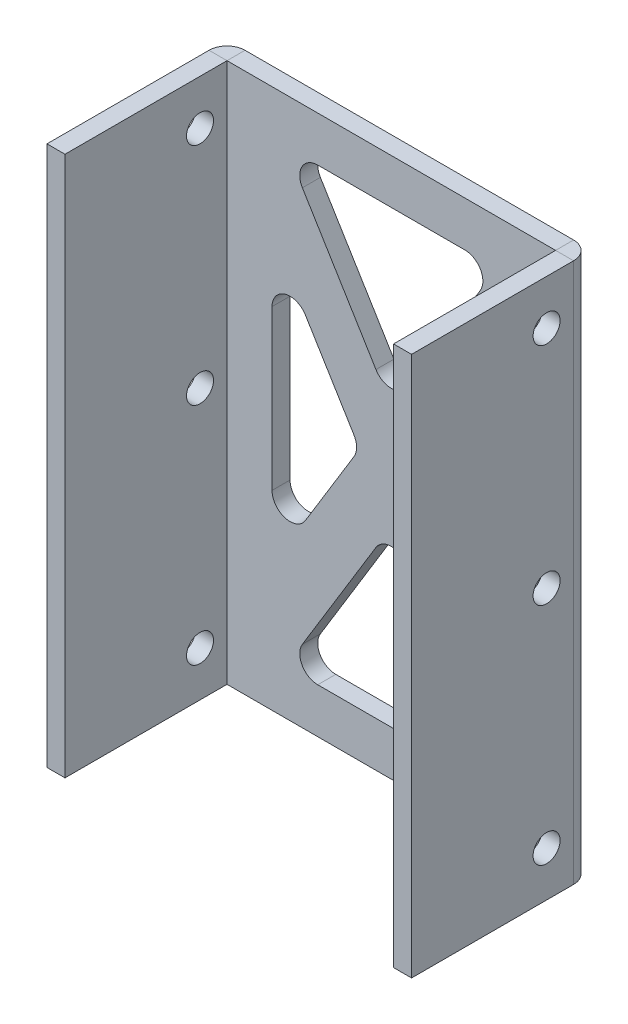
from build123d import *

# Parameters (mm, degrees)
SKETCH_1_W             = 36.5
SKETCH_1_H             = 60
SM_BASE_FLANGE_1_DEPTH = 2
SM_START               = -30
SM_EDGE_FLANGE_1_DEPTH = 60
CUT_EXTRUDE_1_DEPTH    = 10
SKETCH_17_R            = 1.5
CUT_EXTRUDE_2_DEPTH    = 54.518688325


# Read off the part's stored shape, not the designer's step: 邊線-凸緣1
# Sheet-metal steps are written as plain solids
with BuildPart() as part:
    # Sketch 1 → 基材-凸緣1 (new body)
    with BuildSketch(Plane.XY):
        Rectangle(SKETCH_1_W, SKETCH_1_H)
    extrude(amount=-SM_BASE_FLANGE_1_DEPTH)

    # 邊線-凸緣1 outline → 邊線-凸緣1 (add)
    with BuildSketch(Plane(origin=(0, 0, 0), x_dir=(1, 0, 0), z_dir=(0, 1, 0)).offset(SM_START)):
        with BuildLine():
            ThreePointArc((20.25, 0), (19.664213562, 1.414213562), (18.25, 2))
            Line((18.25, 2), (18.25, -18))
            Line((18.25, -18), (20.25, -18))
            Line((20.25, -18), (20.25, 0))
        make_face()
        with BuildLine():
            Line((-20.25, 0), (-20.25, -18))
            Line((-20.25, -18), (-18.25, -18))
            Line((-18.25, -18), (-18.25, 2))
            ThreePointArc((-18.25, 2), (-19.664213562, 1.414213562), (-20.25, 0))
        make_face()
    extrude(amount=SM_EDGE_FLANGE_1_DEPTH)

    # 草圖14 → 除料-伸長1 (cut)
    with BuildSketch(Plane(origin=(0, 0, -2), x_dir=(-1, 0, 0), z_dir=(0, 0, -1))):
        with BuildLine():
            Line((-8.173166384, 25), (8.173166384, 25))
            ThreePointArc((8.173166384, 25), (9.91716134, 23.979020733), (9.880573604, 21.958481596))
            Line((9.880573604, 21.958481596), (1.70740722, 8.559848179))
            ThreePointArc((1.70740722, 8.559848179), (0, 7.601366583), (-1.70740722, 8.559848179))
            Line((-1.70740722, 8.559848179), (-9.880573604, 21.958481596))
            ThreePointArc((-9.880573604, 21.958481596), (-9.91716134, 23.979020733), (-8.173166384, 25))
        make_face()
        with BuildLine():
            Line((-15.25, 12.119944893), (-15.25, -12.119944893))
            ThreePointArc((-15.25, -12.119944893), (-13.79091846, -14.045407751), (-11.54259278, -13.161463297))
            Line((-11.54259278, -13.161463297), (-4.149426396, -1.041518404))
            ThreePointArc((-4.149426396, -1.041518404), (-3.856833616, 0), (-4.149426396, 1.041518404))
            Line((-4.149426396, 1.041518404), (-11.54259278, 13.161463297))
            ThreePointArc((-11.54259278, 13.161463297), (-13.79091846, 14.045407751), (-15.25, 12.119944893))
        make_face()
        with BuildLine():
            Line((-8.173166384, -25), (8.173166384, -25))
            ThreePointArc((8.173166384, -25), (9.91716134, -23.979020733), (9.880573604, -21.958481596))
            Line((9.880573604, -21.958481596), (1.70740722, -8.559848179))
            ThreePointArc((1.70740722, -8.559848179), (0, -7.601366583), (-1.70740722, -8.559848179))
            Line((-1.70740722, -8.559848179), (-9.880573604, -21.958481596))
            ThreePointArc((-9.880573604, -21.958481596), (-9.91716134, -23.979020733), (-8.173166384, -25))
        make_face()
        with BuildLine():
            Line((13.25, 8.841256368), (13.25, -8.841256368))
            ThreePointArc((13.25, -8.841256368), (11.79091846, -10.766719227), (9.54259278, -9.882774772))
            Line((9.54259278, -9.882774772), (4.149426396, -1.041518404))
            ThreePointArc((4.149426396, -1.041518404), (3.856833616, 0), (4.149426396, 1.041518404))
            Line((4.149426396, 1.041518404), (9.54259278, 9.882774772))
            ThreePointArc((9.54259278, 9.882774772), (11.79091846, 10.766719227), (13.25, 8.841256368))
        make_face()
    extrude(amount=-CUT_EXTRUDE_1_DEPTH, mode=Mode.SUBTRACT)

    # 草圖17 → 除料-伸長2 (cut, through all)
    with BuildSketch(Plane(origin=(20.25, 0, 0), x_dir=(0, 0, -1), z_dir=(1, 0, 0))):
        with Locations((-3, 25)):
            Circle(SKETCH_17_R)
        with Locations((-3, -25)):
            Circle(SKETCH_17_R)
        with Locations((-3, 0)):
            Circle(SKETCH_17_R)
    extrude(amount=-CUT_EXTRUDE_2_DEPTH, mode=Mode.SUBTRACT)


solid = part.part
